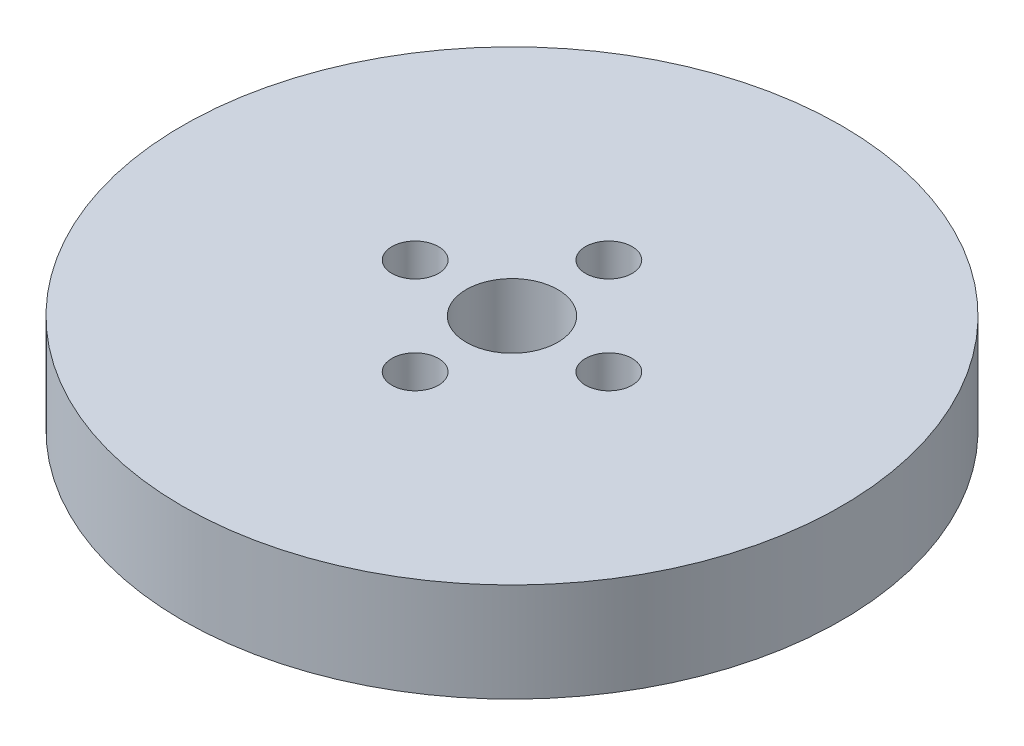
from build123d import *

# Parameters (mm, degrees)
SKETCH1_R           = 90
BOSS_EXTRUDE1_DEPTH = 27
SKETCH2_R           = 12.5
CUT_EXTRUDE1_DEPTH  = 131.111490653
SKETCH3_R           = 6.362706863
CUT_EXTRUDE2_DEPTH  = 21.978856474
CIRPATTERN1_COUNT   = 4


with BuildPart() as part:
    # Sketch1 → Boss-Extrude1 (new body)
    with BuildSketch(Plane(origin=(0, 0, 0), x_dir=(1, 0, 0), z_dir=(0, 1, 0))):
        Circle(SKETCH1_R)
    extrude(amount=BOSS_EXTRUDE1_DEPTH)

    # Sketch2 → Cut-Extrude1 (cut, through all)
    with BuildSketch(Plane(origin=(0, 0, 0), x_dir=(1, 0, 0), z_dir=(0, 1, 0))):
        Circle(SKETCH2_R)
    extrude(amount=CUT_EXTRUDE1_DEPTH, mode=Mode.SUBTRACT)

    # Sketch3 → Cut-Extrude2 (cut)
    with BuildSketch(Plane(origin=(0, 27, 0), x_dir=(1, 0, 0), z_dir=(0, 1, 0))):
        with Locations((-26.445856465, 0)):
            Circle(SKETCH3_R)
    cut_extrude2 = extrude(amount=-CUT_EXTRUDE2_DEPTH, mode=Mode.SUBTRACT)

    # CirPattern1: Cut-Extrude2 ×4 about axis
    cirpattern1_axis = Axis((0, 0, 0), (0, 1, 0))
    for i in range(1, CIRPATTERN1_COUNT):
        add(cut_extrude2.rotate(cirpattern1_axis, i * 360 / CIRPATTERN1_COUNT), mode=Mode.SUBTRACT)


solid = part.part
